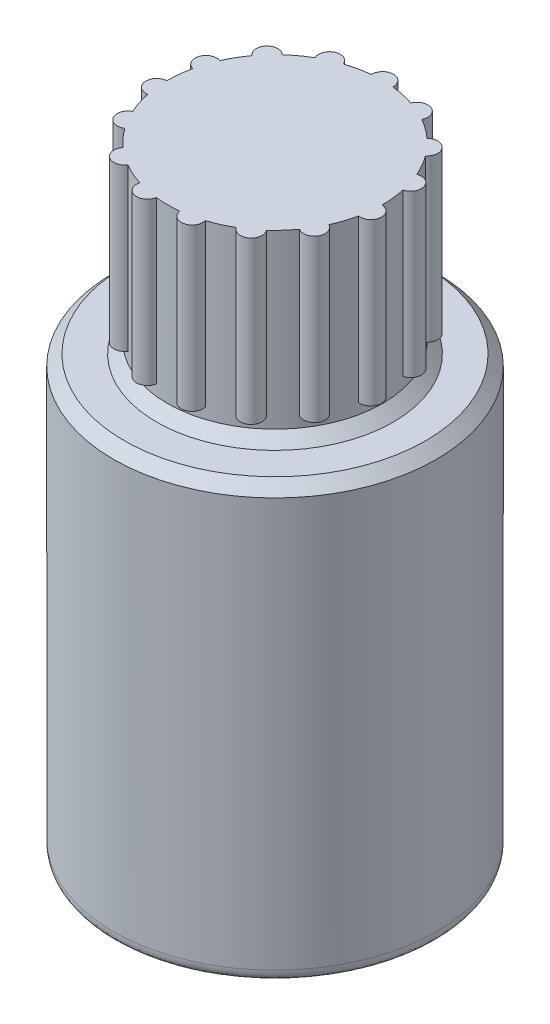
from build123d import *

# Parameters (mm, degrees)
CHAMFER1_SIZE       = 1
FILLET1_SIZE        = 1
SKETCH2_R           = 1
BOSS_EXTRUDE1_DEPTH = 15
CIRPATTERN1_COUNT   = 15


with BuildPart() as part:
    # Sketch1 → Revolve1 (revolve)
    with BuildSketch(Plane.XY, mode=Mode.PRIVATE) as revolve1_sk:
        Polygon((15, 0), (15, 40), (10, 40), (10, 57), (0, 57), (0, 37), (12, 37), (12, 0), align=None)
    revolve(revolve1_sk.sketch.rotate(Axis((0, 57, 0), (0, -1, 0)), 180), axis=Axis((0, 57, 0), (0, -1, 0)))

    # Chamfer1
    chamfer1_edges = [part.edges().sort_by_distance(p)[0] for p in [
        (12, 0, 0),
        (10, 40, 0),
        (15, 40, 0),
    ]]
    chamfer(chamfer1_edges, length=CHAMFER1_SIZE)

    # Fillet1
    # a fillet whose section is not a circle: 1 mm, written as the material it takes off along each edge
    with BuildSketch(Plane(origin=(0, 0, 0), x_dir=(-1, 0, 0), z_dir=(0, 0, 1))) as fillet1_piece_1:
        with BuildLine():
            add(Edge.make_bspline([(15, -FILLET1_SIZE), (15, -FILLET1_SIZE * 0.831801948466), (15, -FILLET1_SIZE * 0.663603896932), (15 - FILLET1_SIZE * 0.0716919198361, -FILLET1_SIZE * 0.292893218813), (15 - FILLET1_SIZE * 0.292893218813, -FILLET1_SIZE * 0.0716919198361), (15 - FILLET1_SIZE * 0.663603896932, 0), (15 - FILLET1_SIZE * 0.831801948466, 0), (15 - FILLET1_SIZE, 0)], knots=[0, 0, 0, 0, 0, 0, 0.5, 0.5, 1, 1, 1, 1, 1, 1], degree=5))
            Line((15 - FILLET1_SIZE, 0), (15, 0))
            Line((15, 0), (15, -FILLET1_SIZE))
        make_face()
    revolve(axis=Axis((0, 0, 0), (0, -1, 0)), mode=Mode.SUBTRACT)

    # Sketch2 → Boss-Extrude1 (add)
    with BuildSketch(Plane(origin=(0, 57, 0), x_dir=(1, 0, 0), z_dir=(0, 1, 0))):
        with Locations((0, 10)):
            Circle(SKETCH2_R)
    boss_extrude1 = extrude(amount=-BOSS_EXTRUDE1_DEPTH)

    # CirPattern1: Boss-Extrude1 ×15 about axis
    cirpattern1_axis = Axis((0, 0, 0), (0, 1, 0))
    for i in range(1, CIRPATTERN1_COUNT):
        add(boss_extrude1.rotate(cirpattern1_axis, i * 360 / CIRPATTERN1_COUNT))


solid = part.part
